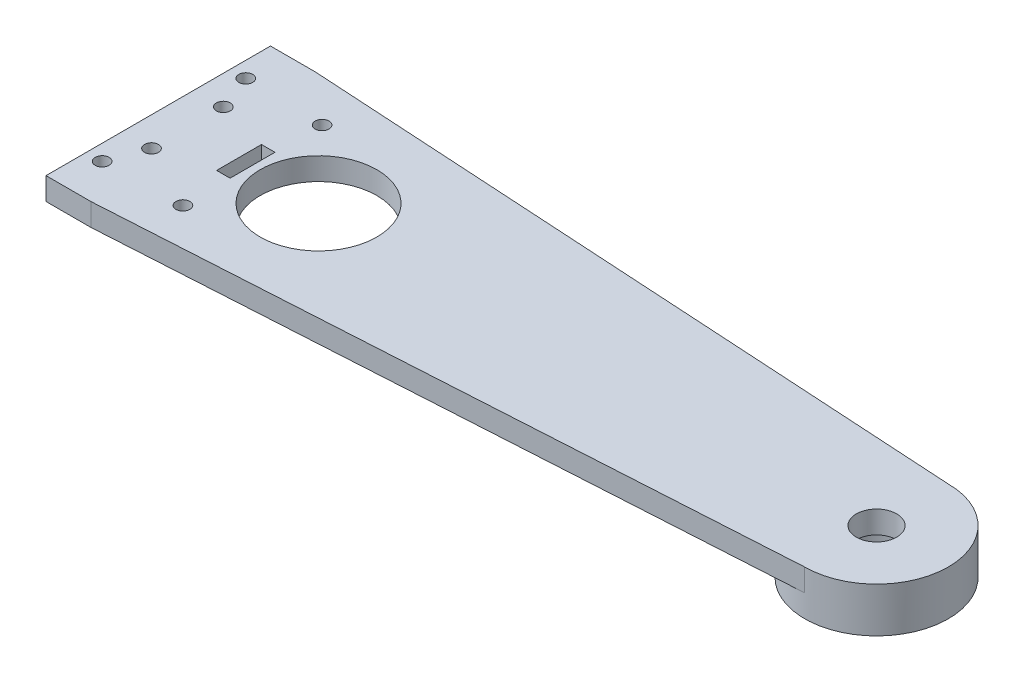
from build123d import *
from build123d.topology import SkipClean

# Parameters (mm, degrees)
SKETCH28_R           = 1.55
SKETCH28_R_2         = 13
SKETCH28_R_3         = 4.5
SKETCH28_W           = 10
SKETCH28_H           = 3
BOSS_EXTRUDE10_DEPTH = 5
SKETCH29_R           = 16
SKETCH29_R_2         = 8.2
BOSS_EXTRUDE11_DEPTH = 5


with BuildPart() as part:
    # Sketch28 → Boss-Extrude10 (new body)
    with BuildSketch(Plane(origin=(-32, 0, 0), x_dir=(0, 0, 1), z_dir=(0, -1, 0))):
        with BuildLine():
            Line((-25, 15), (25, 15))
            Line((25, 15), (25, 5))
            Line((25, 5), (16, -145))
            ThreePointArc((16, -145), (0, -161), (-16, -145))
            Line((-16, -145), (-25, 5))
            Line((-25, 5), (-25, 15))
        make_face()
        with Locations((8, 8.5)):
            Circle(SKETCH28_R, mode=Mode.SUBTRACT)
        with Locations((-8, 8.5)):
            Circle(SKETCH28_R, mode=Mode.SUBTRACT)
        with Locations((16, 11.5)):
            Circle(SKETCH28_R, mode=Mode.SUBTRACT)
        with Locations((-16, 11.5)):
            Circle(SKETCH28_R, mode=Mode.SUBTRACT)
        with Locations((-15.5, -6)):
            Circle(SKETCH28_R, mode=Mode.SUBTRACT)
        with Locations((15.5, -6)):
            Circle(SKETCH28_R, mode=Mode.SUBTRACT)
        with Locations((0, -20.7)):
            Circle(SKETCH28_R_2, mode=Mode.SUBTRACT)
        with Locations((0, -145)):
            Circle(SKETCH28_R_3, mode=Mode.SUBTRACT)
        with Locations((0, -4.5)):
            Rectangle(SKETCH28_W, SKETCH28_H, mode=Mode.SUBTRACT)
    extrude(amount=BOSS_EXTRUDE10_DEPTH)

    # Sketch29 → Boss-Extrude11 (add)
    with SkipClean():  # the faces are left unmerged after this step: merging them gives an invalid solid
        with BuildSketch(Plane.XZ.offset(5)):
            with Locations((113, 0)):
                Circle(SKETCH29_R)
            with Locations((113, 0)):
                Circle(SKETCH29_R_2, mode=Mode.SUBTRACT)
        extrude(amount=BOSS_EXTRUDE11_DEPTH)
    add(part.part.scale(1), mode=Mode.REPLACE)  # the faces are merged on a copy


solid = part.part
